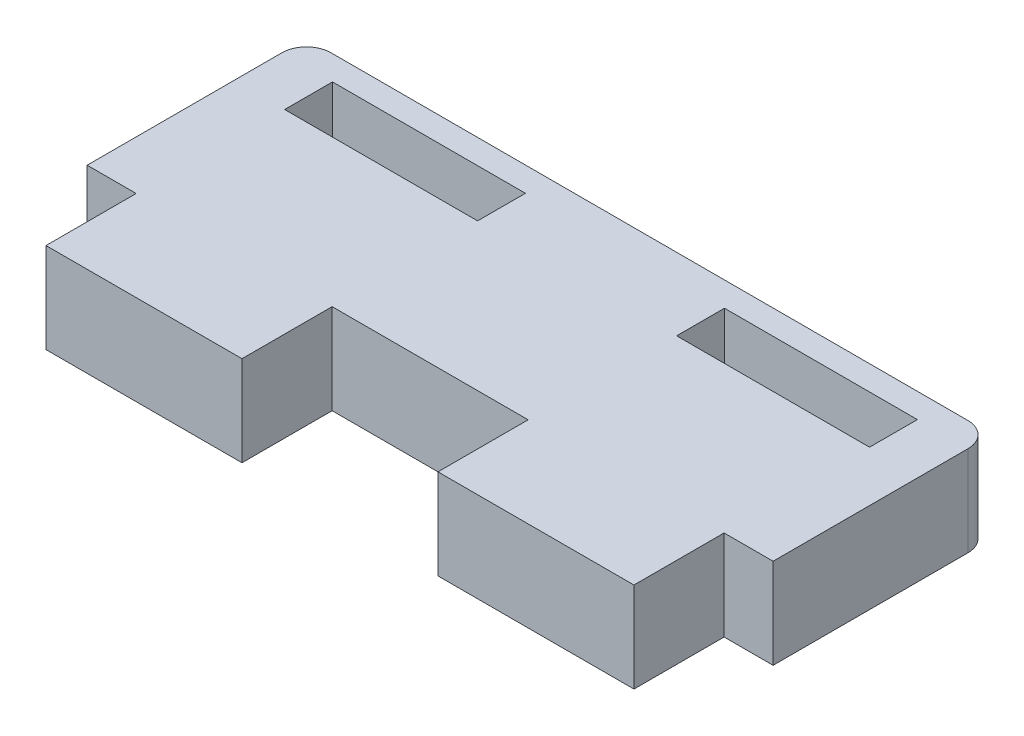
from build123d import *

# Parameters (mm, degrees)
SKETCH1_W           = 12.5
SKETCH1_H           = 3.0988
BOSS_EXTRUDE1_DEPTH = 5.842
FILLET1_R           = 1.5875


with BuildPart() as part:
    # Sketch1 → Boss-Extrude1 (new body)
    with BuildSketch(Plane(origin=(0, 0, 0), x_dir=(1, 0, 0), z_dir=(0, 1, 0))):
        Polygon((22.225, -4.7625), (19.05, -4.7625), (19.05, -10.6045), (6.35, -10.6045), (6.35, -4.7625), (-6.35, -4.7625), (-6.35, -10.6045), (-19.05, -10.6045), (-19.05, -4.7625), (-22.225, -4.7625), (-22.225, 4.7625), (-22.225, 7.8613), (-22.225, 9.4488), (22.225, 9.4488), (22.225, 7.8613), (22.225, 4.7625), align=None)
        with Locations((12.7, 6.3119)):
            Rectangle(SKETCH1_W, SKETCH1_H, mode=Mode.SUBTRACT)
        with Locations((-12.7, 6.3119)):
            Rectangle(SKETCH1_W, SKETCH1_H, mode=Mode.SUBTRACT)
    extrude(amount=BOSS_EXTRUDE1_DEPTH)

    # Fillet1
    fillet1_edges = [part.edges().sort_by_distance(p)[0] for p in [
        (22.225, 2.921, -9.4488),
        (-22.225, 2.921, -9.4488),
    ]]
    fillet(fillet1_edges, radius=FILLET1_R)


solid = part.part
